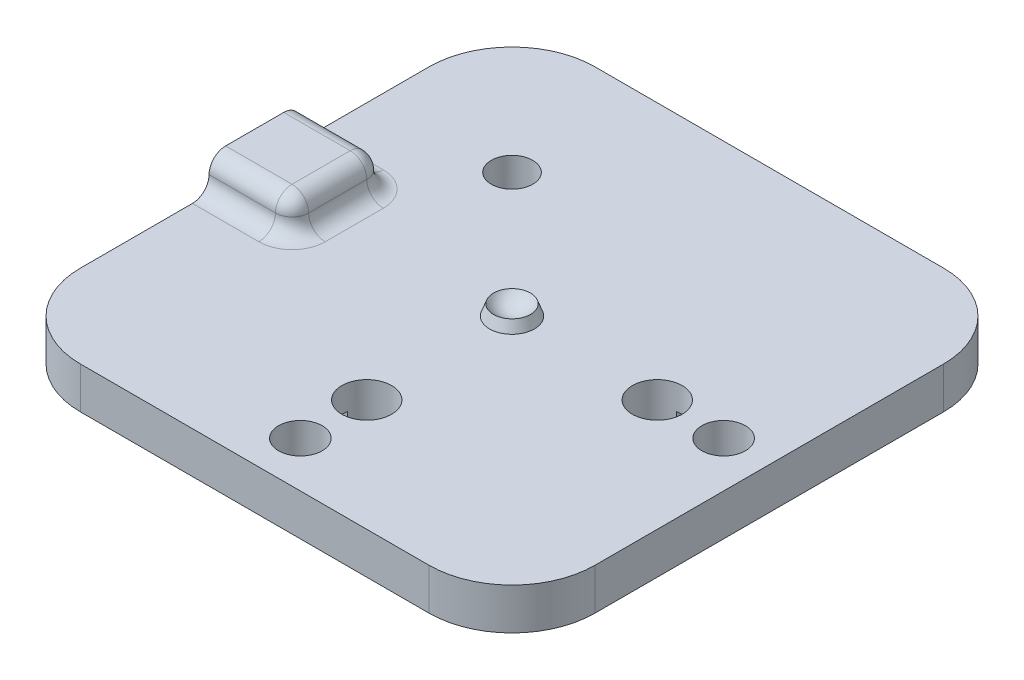
from build123d import *

# Parameters (mm, degrees)
SKETCH4_W           = 62
SKETCH4_H           = 62
SKETCH4_R           = 3
SKETCH4_R_2         = 2.5
SKETCH4_R_3         = 2.625
BOSS_EXTRUDE2_DEPTH = 5
SKETCH5_W           = 10.4
SKETCH5_H           = 1.2
SKETCH5_W_2         = 1.2
SKETCH5_H_2         = 10.4
CUT_EXTRUDE1_DEPTH  = 2
FILLET1_R           = 10
SKETCH6_W           = 10
SKETCH6_H           = 11
BOSS_EXTRUDE3_DEPTH = 4
SKETCH7_R           = 2.6
CUT_EXTRUDE2_DEPTH  = 9
CHAMFER1_SIZE       = 1
FILLET2_R           = 2


with BuildPart() as part:
    # Sketch3 → Revolve1 (revolve)
    with BuildSketch(Plane.XY, mode=Mode.PRIVATE) as revolve1_sk:
        with BuildLine():
            Line((0, 0), (2.7, 0))
            Line((2.7, 0), (2.233206222, 1.282505364))
            ThreePointArc((2.233206222, 1.282505364), (1.26348021, 0.413869711), (0, 0.1))
            Line((0, 0.1), (0, 0))
        make_face()
    revolve(revolve1_sk.sketch.rotate(Axis((0, 0.1, 0), (0, -1, 0)), 90), axis=Axis((0, 0.1, 0), (0, -1, 0)))

    # Sketch4 → Boss-Extrude2 (add)
    with BuildSketch(Plane.XZ):
        Rectangle(SKETCH4_W, SKETCH4_H)
        with Locations(Location((17.5, 0, 0), (0, 0, 270))):
            Circle(SKETCH4_R, mode=Mode.SUBTRACT)
        with Locations(Location((0, 17.5, 0), (0, 0, 270))):
            Circle(SKETCH4_R, mode=Mode.SUBTRACT)
        with Locations(Location((-15, -15, 0), (0, 0, 270))):
            Circle(SKETCH4_R_2, mode=Mode.SUBTRACT)
        with Locations(Location((0, 25.5, 0), (0, 0, 270))):
            Circle(SKETCH4_R_3, mode=Mode.SUBTRACT)
        with Locations(Location((25.5, 0, 0), (0, 0, 270))):
            Circle(SKETCH4_R_3, mode=Mode.SUBTRACT)
    extrude(amount=BOSS_EXTRUDE2_DEPTH)

    # Sketch5 → Cut-Extrude1 (cut)
    with BuildSketch(Plane.XZ.offset(5)):
        with Locations((0, 17.5)):
            Rectangle(SKETCH5_W, SKETCH5_H)
        with Locations((17.5, 0)):
            Rectangle(SKETCH5_W_2, SKETCH5_H_2)
        Polygon((-18.252691193, -10.898780669), (-10.898780669, -18.252691193), (-11.747308807, -19.101219331), (-19.101219331, -11.747308807), align=None)
    extrude(amount=-CUT_EXTRUDE1_DEPTH, mode=Mode.SUBTRACT)

    # Fillet1
    fillet1_edges = [part.edges().sort_by_distance(p)[0] for p in [
        (31, -2.5, -31),
        (31, -2.5, 31),
        (-31, -2.5, 31),
        (-31, -2.5, -31),
    ]]
    fillet(fillet1_edges, radius=FILLET1_R)

    # Sketch6 → Boss-Extrude3 (add)
    with BuildSketch(Plane(origin=(0, 0, 0), x_dir=(1, 0, 0), z_dir=(0, 1, 0))):
        with Locations((-26, 0)):
            Rectangle(SKETCH6_W, SKETCH6_H)
    extrude(amount=BOSS_EXTRUDE3_DEPTH)

    # Sketch7 → Cut-Extrude2 (cut)
    with BuildSketch(Plane.ZY.offset(31)):
        with Locations((0, -0.5)):
            Circle(SKETCH7_R)
    extrude(amount=-CUT_EXTRUDE2_DEPTH, mode=Mode.SUBTRACT)

    # Chamfer1
    chamfer1_edges = [part.edges().sort_by_distance(p)[0] for p in [
        (-31, -0.5, -2.6),
    ]]
    chamfer(chamfer1_edges, length=CHAMFER1_SIZE)

    # Fillet2
    fillet2_edges = [part.edges().sort_by_distance(p)[0] for p in [
        (-26, 0, 5.5),
        (-21, 0, 0),
        (-21, 2, 5.5),
        (-26, 0, -5.5),
        (-21, 2, -5.5),
        (-26, 4, 5.5),
        (-21, 4, 0),
        (-26, 4, -5.5),
    ]]
    fillet(fillet2_edges, radius=FILLET2_R - 0.0001)  # a hair under: the kernel refuses the full size


solid = part.part
